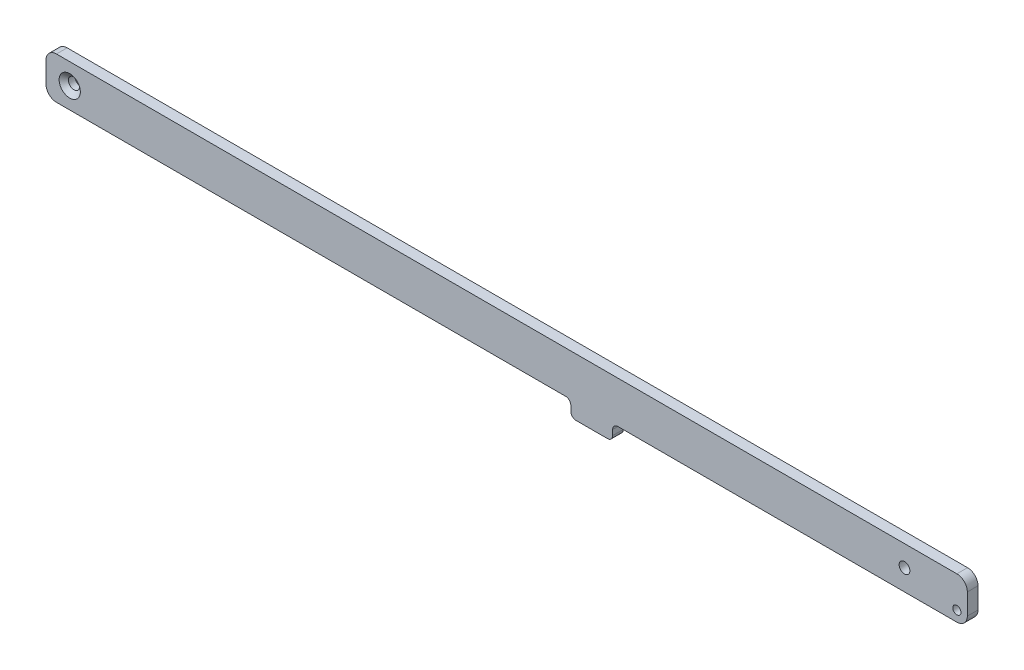
from build123d import *

# Parameters (mm, degrees)
SKETCH1_R                                           = 2.4892
BOSS_EXTRUDE1_DEPTH                                 = 6.477
FILLET2_R                                           = 6.35
FILLET3_R                                           = 3.175
CSK_FOR_1_4_FLAT_HEAD_MACHINE_SCREW_100_D           = 6.7564
CSK_FOR_1_4_FLAT_HEAD_MACHINE_SCREW_100_DEPTH       = 19.05
CSK_FOR_1_4_FLAT_HEAD_MACHINE_SCREW_100_CSINK_D     = 12.8778
CSK_FOR_1_4_FLAT_HEAD_MACHINE_SCREW_100_CSINK_ANGLE = 100
CSK_FOR_1_4_FLAT_HEAD_MACHINE_SCREW_100_TIP         = 2.029827343
SKETCH2_R                                           = 3.2639
CUT_EXTRUDE1_DEPTH                                  = 560.414472041


with BuildPart() as part:
    # Sketch1 → Boss-Extrude1 (new body)
    with BuildSketch(Plane.XY):
        Polygon((0, 25.4), (0, 0), (40.53078, 0), (318.31026, 0), (318.31026, -9.525), (343.71026, -9.525), (343.71026, 0), (558.8, 0), (558.8, 25.4), (40.530665192, 25.4), align=None)
        with Locations((552.45, 6.35)):
            Circle(SKETCH1_R, mode=Mode.SUBTRACT)
    extrude(amount=BOSS_EXTRUDE1_DEPTH)

    # Fillet2
    fillet2_edges = [part.edges().sort_by_distance(p)[0] for p in [
        (558.8, 25.4, 3.2385),
        (0, 0, 3.2385),
        (0, 25.4, 3.2385),
        (558.8, 0, 3.2385),
    ]]
    fillet(fillet2_edges, radius=FILLET2_R)

    # Fillet3
    fillet3_edges = [part.edges().sort_by_distance(p)[0] for p in [
        (318.31026, 0, 3.2385),
        (318.31026, -9.525, 3.2385),
        (343.71026, -9.525, 3.2385),
        (343.71026, 0, 3.2385),
    ]]
    fillet(fillet3_edges, radius=FILLET3_R)

    # CSK for 1/4 Flat Head Machine Screw (100)2
    with Locations(Plane.XY.offset(6.477)):
        with Locations((14.393926, 12.7)):
            CounterSinkHole(CSK_FOR_1_4_FLAT_HEAD_MACHINE_SCREW_100_D / 2, CSK_FOR_1_4_FLAT_HEAD_MACHINE_SCREW_100_CSINK_D / 2, depth=CSK_FOR_1_4_FLAT_HEAD_MACHINE_SCREW_100_DEPTH, counter_sink_angle=CSK_FOR_1_4_FLAT_HEAD_MACHINE_SCREW_100_CSINK_ANGLE)
            with Locations((0, 0, -(CSK_FOR_1_4_FLAT_HEAD_MACHINE_SCREW_100_DEPTH + CSK_FOR_1_4_FLAT_HEAD_MACHINE_SCREW_100_TIP / 2))):  # 118° drill point
                Cone(0, CSK_FOR_1_4_FLAT_HEAD_MACHINE_SCREW_100_D / 2, CSK_FOR_1_4_FLAT_HEAD_MACHINE_SCREW_100_TIP, mode=Mode.SUBTRACT)

    # Sketch2 → Cut-Extrude1 (cut, through all)
    with BuildSketch(Plane.XY.offset(6.477)):
        with Locations((520.7, 12.7)):
            Circle(SKETCH2_R)
    extrude(amount=-CUT_EXTRUDE1_DEPTH, mode=Mode.SUBTRACT)


solid = part.part
